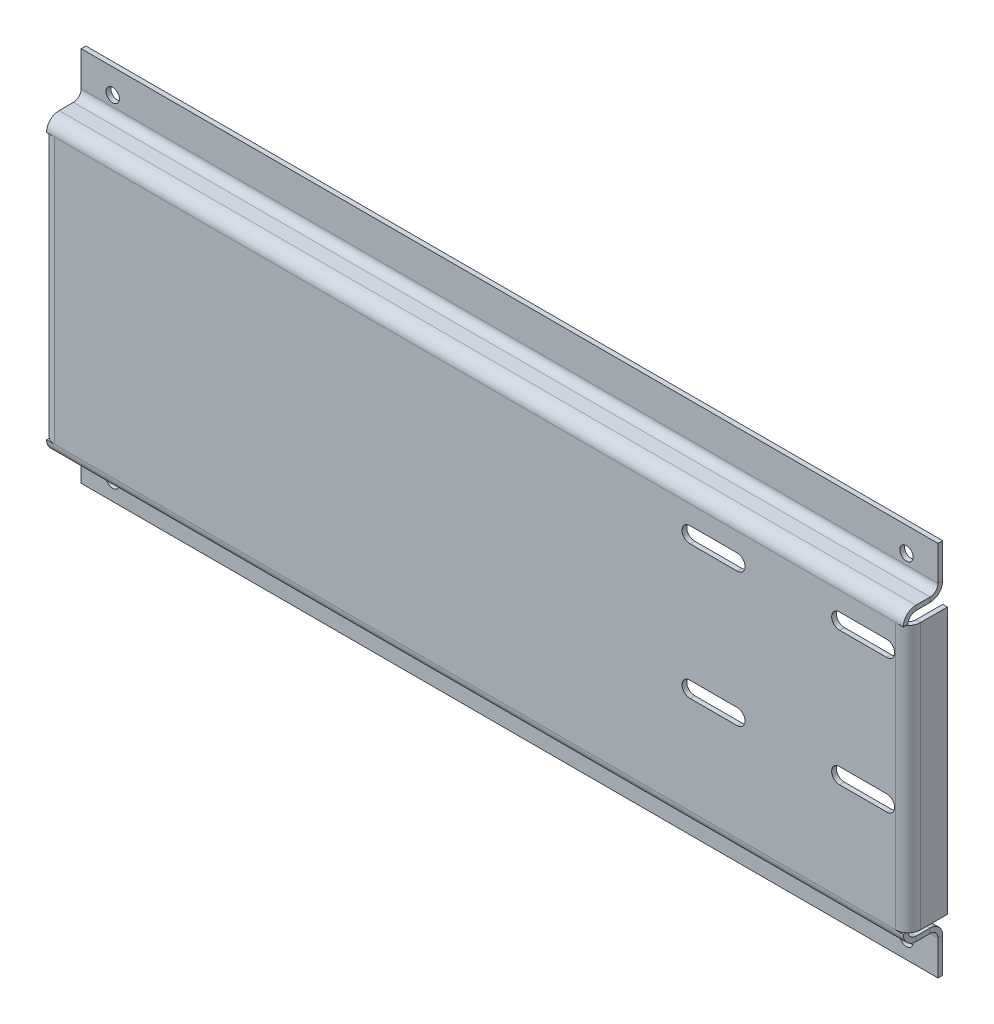
from build123d import *

# Parameters (mm, degrees)
SKETCH1_W                    = 544
SKETCH1_H                    = 185
BASE_FLANGE1_DEPTH           = 3
EDGE_FLANGE1_STRIP_W         = 22
EDGE_FLANGE1_STRIP_H         = 3
EDGE_FLANGE1_STRIP_CUT_DEPTH = 544
EDGE_FLANGE1_DEPTH           = 544
EDGE_FLANGE2_STRIP_W         = 22
EDGE_FLANGE2_STRIP_H         = 3
EDGE_FLANGE2_STRIP_CUT_DEPTH = 544
EDGE_FLANGE2_DEPTH           = 544
EDGE_FLANGE3_STRIP_W         = 22
EDGE_FLANGE3_STRIP_H         = 3
EDGE_FLANGE3_STRIP_CUT_DEPTH = 544
EDGE_FLANGE3_DEPTH           = 544
EDGE_FLANGE4_STRIP_W         = 22
EDGE_FLANGE4_STRIP_H         = 3
EDGE_FLANGE4_STRIP_CUT_DEPTH = 544
EDGE_FLANGE4_DEPTH           = 544
EDGE_FLANGE5_STRIP_W         = 22
EDGE_FLANGE5_STRIP_H         = 3
EDGE_FLANGE5_STRIP_CUT_DEPTH = 169
EDGE_FLANGE5_DEPTH           = 169
EDGE_FLANGE6_STRIP_W         = 22
EDGE_FLANGE6_STRIP_H         = 3
EDGE_FLANGE6_STRIP_CUT_DEPTH = 169
EDGE_FLANGE6_DEPTH           = 169
SKETCH26_R                   = 4.25
CUT_EXTRUDE1_DEPTH           = 10
SKETCH27_R                   = 4.25
CUT_EXTRUDE2_DEPTH           = 10


# Sheet-metal steps are written as plain solids
with BuildPart() as part:
    # Sketch1 → Base-Flange1 (new body)
    with BuildSketch(Plane.XY):
        with Locations((-108.962758621, -57.524490421)):
            Rectangle(SKETCH1_W, SKETCH1_H)
        with BuildLine():
            Line((152.537241379, 4.975509579), (122.537241379, 4.975509579))
            ThreePointArc((122.537241379, 4.975509579), (117.537241379, 9.975509579), (122.537241379, 14.975509579))
            Line((122.537241379, 14.975509579), (152.537241379, 14.975509579))
            ThreePointArc((152.537241379, 14.975509579), (157.537241379, 9.975509579), (152.537241379, 4.975509579))
        make_face(mode=Mode.SUBTRACT)
        with BuildLine():
            Line((57.537241379, 4.975509579), (27.537241379, 4.975509579))
            ThreePointArc((27.537241379, 4.975509579), (22.537241379, 9.975509579), (27.537241379, 14.975509579))
            Line((27.537241379, 14.975509579), (57.537241379, 14.975509579))
            ThreePointArc((57.537241379, 14.975509579), (62.537241379, 9.975509579), (57.537241379, 4.975509579))
        make_face(mode=Mode.SUBTRACT)
        with BuildLine():
            Line((152.537241379, -80.024490421), (122.537241379, -80.024490421))
            ThreePointArc((122.537241379, -80.024490421), (117.537241379, -75.024490421), (122.537241379, -70.024490421))
            Line((122.537241379, -70.024490421), (152.537241379, -70.024490421))
            ThreePointArc((152.537241379, -70.024490421), (157.537241379, -75.024490421), (152.537241379, -80.024490421))
        make_face(mode=Mode.SUBTRACT)
        with BuildLine():
            Line((57.537241379, -80.024490421), (27.537241379, -80.024490421))
            ThreePointArc((27.537241379, -80.024490421), (22.537241379, -75.024490421), (27.537241379, -70.024490421))
            Line((27.537241379, -70.024490421), (57.537241379, -70.024490421))
            ThreePointArc((57.537241379, -70.024490421), (62.537241379, -75.024490421), (57.537241379, -80.024490421))
        make_face(mode=Mode.SUBTRACT)
    extrude(amount=-BASE_FLANGE1_DEPTH)

    # Edge-Flange1 strip (across the edge) → Edge-Flange1 strip cut (cut)
    with BuildSketch(Plane(origin=(-380.962758621, 34.975509579, -3), x_dir=(0, -1, 0), z_dir=(1, 0, 0))):
        with Locations((-3, -1.5)):
            Rectangle(EDGE_FLANGE1_STRIP_W, EDGE_FLANGE1_STRIP_H)
    extrude(amount=EDGE_FLANGE1_STRIP_CUT_DEPTH, mode=Mode.SUBTRACT)

    # Edge-Flange1 section (across the edge) → Edge-Flange1 (add)
    with BuildSketch(Plane(origin=(-380.962758621, 34.975509579, -3), x_dir=(0, -1, 0), z_dir=(1, 0, 0))):
        with BuildLine():
            Line((0, 5), (0, 22))
            Line((0, 22), (3, 22))
            Line((3, 22), (3, 5))
            ThreePointArc((3, 5), (4.464466094, 1.464466094), (8, 0))
            Line((8, 0), (8, -3))
            ThreePointArc((8, -3), (2.343145751, -0.656854249), (0, 5))
        make_face()
    extrude(amount=EDGE_FLANGE1_DEPTH)

    # Edge-Flange2 strip (across the edge) → Edge-Flange2 strip cut (cut)
    with BuildSketch(Plane(origin=(163.037241379, -150.024490421, -3), x_dir=(0, 1, 0), z_dir=(-1, 0, 0))):
        with Locations((-3, -1.5)):
            Rectangle(EDGE_FLANGE2_STRIP_W, EDGE_FLANGE2_STRIP_H)
    extrude(amount=EDGE_FLANGE2_STRIP_CUT_DEPTH, mode=Mode.SUBTRACT)

    # Edge-Flange2 section (across the edge) → Edge-Flange2 (add)
    with BuildSketch(Plane(origin=(163.037241379, -150.024490421, -3), x_dir=(0, 1, 0), z_dir=(-1, 0, 0))):
        with BuildLine():
            Line((0, 5), (0, 22))
            Line((0, 22), (3, 22))
            Line((3, 22), (3, 5))
            ThreePointArc((3, 5), (4.464466094, 1.464466094), (8, 0))
            Line((8, 0), (8, -3))
            ThreePointArc((8, -3), (2.343145751, -0.656854249), (0, 5))
        make_face()
    extrude(amount=EDGE_FLANGE2_DEPTH)

    # Edge-Flange3 strip (across the edge) → Edge-Flange3 strip cut (cut)
    with BuildSketch(Plane(origin=(-380.962758621, -150.024490421, -25), x_dir=(0, 0, 1), z_dir=(1, 0, 0))):
        with Locations((-3, -1.5)):
            Rectangle(EDGE_FLANGE3_STRIP_W, EDGE_FLANGE3_STRIP_H)
    extrude(amount=EDGE_FLANGE3_STRIP_CUT_DEPTH, mode=Mode.SUBTRACT)

    # Edge-Flange3 section (across the edge) → Edge-Flange3 (add)
    with BuildSketch(Plane(origin=(-380.962758621, -150.024490421, -25), x_dir=(0, 0, 1), z_dir=(1, 0, 0))):
        with BuildLine():
            Line((0, 5), (0, 27))
            Line((0, 27), (3, 27))
            Line((3, 27), (3, 5))
            ThreePointArc((3, 5), (4.464466094, 1.464466094), (8, 0))
            Line((8, 0), (8, -3))
            ThreePointArc((8, -3), (2.343145751, -0.656854249), (0, 5))
        make_face()
    extrude(amount=EDGE_FLANGE3_DEPTH)

    # Edge-Flange4 strip (across the edge) → Edge-Flange4 strip cut (cut)
    with BuildSketch(Plane(origin=(163.037241379, 34.975509579, -25), x_dir=(0, 0, 1), z_dir=(-1, 0, 0))):
        with Locations((-3, -1.5)):
            Rectangle(EDGE_FLANGE4_STRIP_W, EDGE_FLANGE4_STRIP_H)
    extrude(amount=EDGE_FLANGE4_STRIP_CUT_DEPTH, mode=Mode.SUBTRACT)

    # Edge-Flange4 section (across the edge) → Edge-Flange4 (add)
    with BuildSketch(Plane(origin=(163.037241379, 34.975509579, -25), x_dir=(0, 0, 1), z_dir=(-1, 0, 0))):
        with BuildLine():
            Line((0, 5), (0, 27))
            Line((0, 27), (3, 27))
            Line((3, 27), (3, 5))
            ThreePointArc((3, 5), (4.464466094, 1.464466094), (8, 0))
            Line((8, 0), (8, -3))
            ThreePointArc((8, -3), (2.343145751, -0.656854249), (0, 5))
        make_face()
    extrude(amount=EDGE_FLANGE4_DEPTH)

    # Edge-Flange5 strip (across the edge) → Edge-Flange5 strip cut (cut)
    with BuildSketch(Plane(origin=(163.037241379, 26.975509579, -3), x_dir=(-1, 0, 0), z_dir=(0, -1, 0))):
        with Locations((-6, -1.5)):
            Rectangle(EDGE_FLANGE5_STRIP_W, EDGE_FLANGE5_STRIP_H)
    extrude(amount=EDGE_FLANGE5_STRIP_CUT_DEPTH, mode=Mode.SUBTRACT)

    # Edge-Flange5 section (across the edge) → Edge-Flange5 (add)
    with BuildSketch(Plane(origin=(163.037241379, 26.975509579, -3), x_dir=(-1, 0, 0), z_dir=(0, -1, 0))):
        with BuildLine():
            Line((-3, 5), (-3, 22))
            Line((-3, 22), (0, 22))
            Line((0, 22), (0, 5))
            ThreePointArc((0, 5), (1.464466094, 1.464466094), (5, 0))
            Line((5, 0), (5, -3))
            ThreePointArc((5, -3), (-0.656854249, -0.656854249), (-3, 5))
        make_face()
    extrude(amount=EDGE_FLANGE5_DEPTH)

    # Edge-Flange6 strip (across the edge) → Edge-Flange6 strip cut (cut)
    with BuildSketch(Plane(origin=(-380.962758621, -142.024490421, -3), x_dir=(1, 0, 0), z_dir=(0, 1, 0))):
        with Locations((-6, -1.5)):
            Rectangle(EDGE_FLANGE6_STRIP_W, EDGE_FLANGE6_STRIP_H)
    extrude(amount=EDGE_FLANGE6_STRIP_CUT_DEPTH, mode=Mode.SUBTRACT)

    # Edge-Flange6 section (across the edge) → Edge-Flange6 (add)
    with BuildSketch(Plane(origin=(-380.962758621, -142.024490421, -3), x_dir=(1, 0, 0), z_dir=(0, 1, 0))):
        with BuildLine():
            Line((-3, 5), (-3, 22))
            Line((-3, 22), (0, 22))
            Line((0, 22), (0, 5))
            ThreePointArc((0, 5), (1.464466094, 1.464466094), (5, 0))
            Line((5, 0), (5, -3))
            ThreePointArc((5, -3), (-0.656854249, -0.656854249), (-3, 5))
        make_face()
    extrude(amount=EDGE_FLANGE6_DEPTH)

    # Sketch26 → Cut-Extrude1 (cut)
    with BuildSketch(Plane.XY.offset(-22)):
        with Locations((143.037241379, -165.524490421)):
            Circle(SKETCH26_R)
        with Locations((-360.962758621, -165.524490421)):
            Circle(SKETCH26_R)
    extrude(amount=-CUT_EXTRUDE1_DEPTH, mode=Mode.SUBTRACT)

    # Sketch27 → Cut-Extrude2 (cut)
    with BuildSketch(Plane.XY.offset(-22)):
        with Locations((143.037241379, 46.475509579)):
            Circle(SKETCH27_R)
        with Locations((-360.962758621, 46.475509579)):
            Circle(SKETCH27_R)
    extrude(amount=-CUT_EXTRUDE2_DEPTH, mode=Mode.SUBTRACT)


solid = part.part
